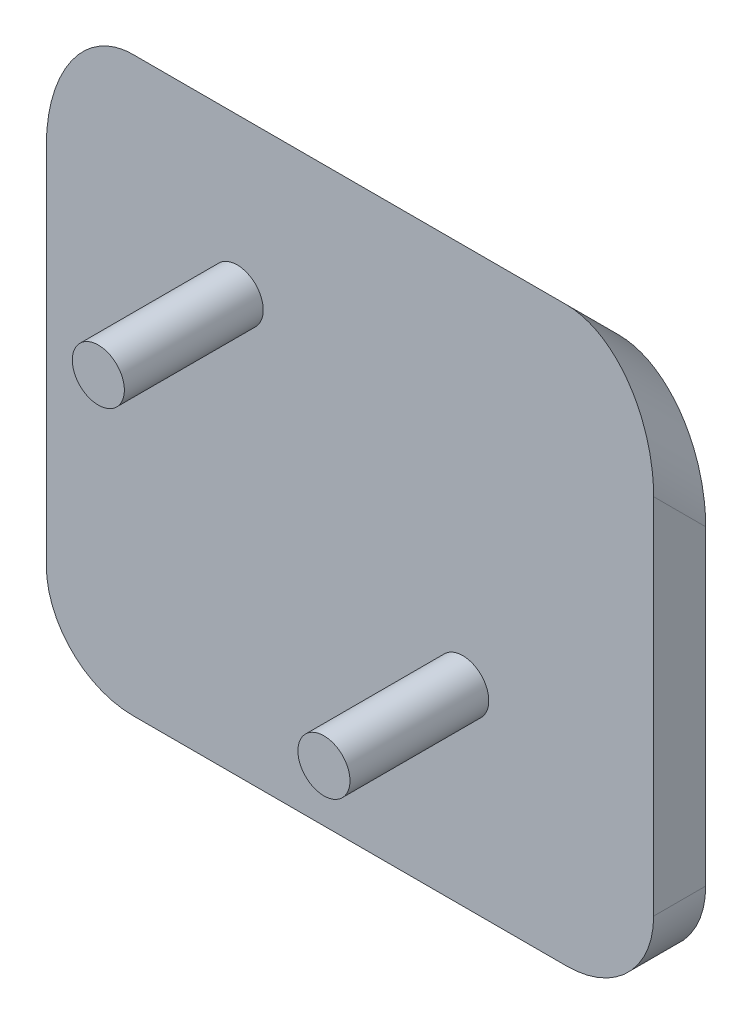
from build123d import *

# Parameters (mm, degrees)
SKETCH1_W           = 35
SKETCH1_H           = 35
BOSS_EXTRUDE1_DEPTH = 3
SKETCH2_R           = 1.5
BOSS_EXTRUDE2_DEPTH = 8
CHAMFER1_SIZE       = 5
FILLET1_R           = 5


with BuildPart() as part:
    # Sketch1 → Boss-Extrude1 (new body)
    with BuildSketch(Plane.XY):
        with Locations((17.5, 17.5)):
            Rectangle(SKETCH1_W, SKETCH1_H)
    extrude(amount=BOSS_EXTRUDE1_DEPTH)

    # Sketch2 → Boss-Extrude2 (add)
    with BuildSketch(Plane.XY.offset(3)):
        with Locations(Location((11, 24, 0), (0, 0, 180))):
            Circle(SKETCH2_R)
        with Locations(Location((24, 11, 0), (0, 0, 180))):
            Circle(SKETCH2_R)
    extrude(amount=BOSS_EXTRUDE2_DEPTH)

    # Chamfer1
    # the kernel refuses this chamfer: 5 mm, written as the material it takes off along each edge
    with BuildSketch(Plane(origin=(47.85841494, 35, 0), x_dir=(0, -0.9996219169112968, -0.027495876610586372), z_dir=(-1, 0, 0))) as chamfer1_piece_1:
        Polygon((CHAMFER1_SIZE * 0.999621916911, CHAMFER1_SIZE * 0.0274958766106), (-CHAMFER1_SIZE * 0.0274958766106, CHAMFER1_SIZE * 0.999621916911), (0, 0), align=None)
    extrude(amount=60.71682988, mode=Mode.SUBTRACT)

    # Fillet1
    # the kernel refuses this fillet: 5 mm, written as the material it takes off along each edge
    with BuildSketch(Plane(origin=(0, 21.161165235, -8.838834765), x_dir=(0, -0.7071067811868302, 0.7071067811862648), z_dir=(0, 0.7071067811862648, 0.7071067811868302)), Plane(origin=(35, 41.838834765, 11.838834765), x_dir=(0, -0.7071067811868302, 0.7071067811862648), z_dir=(0, -0.7071067811862648, -0.7071067811868302))) as fillet1_piece_1:
        with BuildLine():
            CenterArc((FILLET1_R, FILLET1_R), FILLET1_R, 180, 90)
            Line((0, FILLET1_R), (0, 0))
            Line((0, 0), (FILLET1_R, 0))
        make_face()
    extrude(amount=29.242640687, mode=Mode.SUBTRACT)
    with BuildSketch(Plane(origin=(35, 0, -12.5), x_dir=(-1, 0, 0), z_dir=(0, 0, 1))) as fillet1_piece_2:
        with BuildLine():
            CenterArc((FILLET1_R, -FILLET1_R), FILLET1_R, 90, 90)
            Line((0, -FILLET1_R), (0, 0))
            Line((0, 0), (FILLET1_R, 0))
        make_face()
    extrude(amount=28, mode=Mode.SUBTRACT)
    with BuildSketch(Plane(origin=(0, 0, -12.5), x_dir=(1, 0, 0), z_dir=(0, 0, 1))) as fillet1_piece_3:
        with BuildLine():
            CenterArc((FILLET1_R, FILLET1_R), FILLET1_R, 180, 90)
            Line((0, FILLET1_R), (0, 0))
            Line((0, 0), (FILLET1_R, 0))
        make_face()
    extrude(amount=28, mode=Mode.SUBTRACT)


solid = part.part
